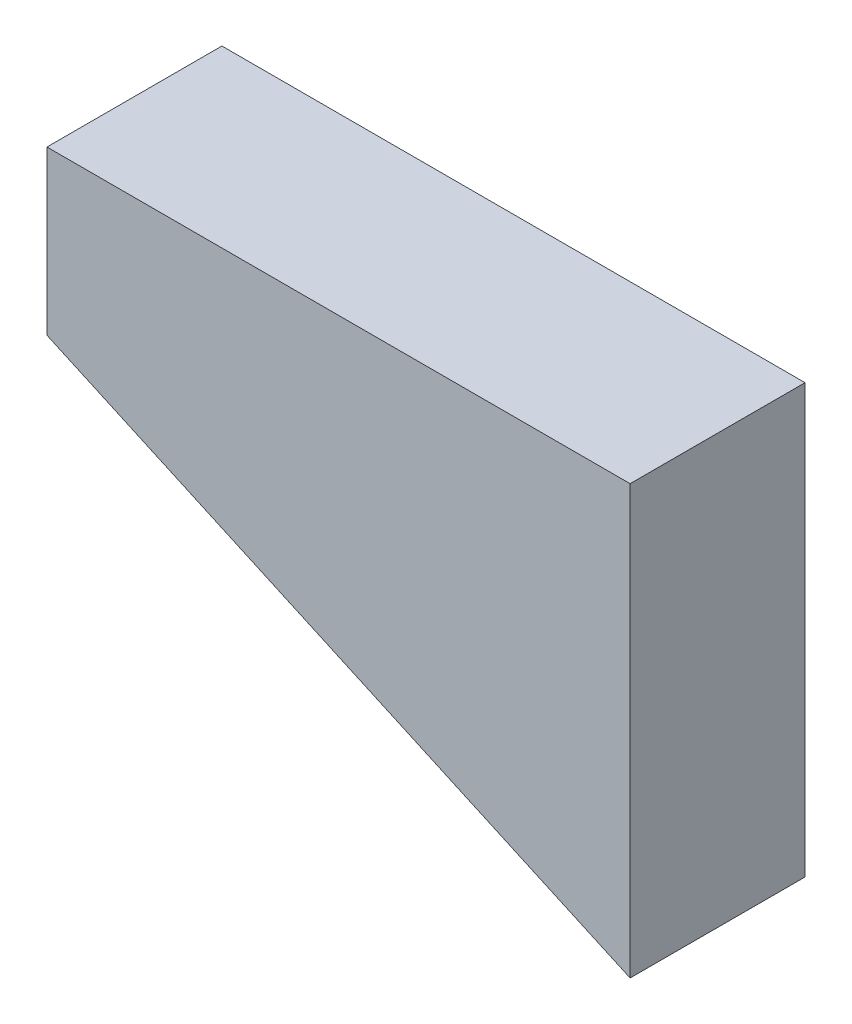
from build123d import *

# Parameters (mm, degrees)
BOSS_EXTRUDE1_DEPTH = 19.05


with BuildPart() as part:
    # Sketch1 → Boss-Extrude1 (new body)
    with BuildSketch(Plane.XY):
        Polygon((-673.68449825, 1733.829526185), (-673.68449825, 1780.446787186), (-737.18449825, 1780.446787186), (-737.18449825, 1762.693162548), align=None)
    extrude(amount=BOSS_EXTRUDE1_DEPTH)


solid = part.part
